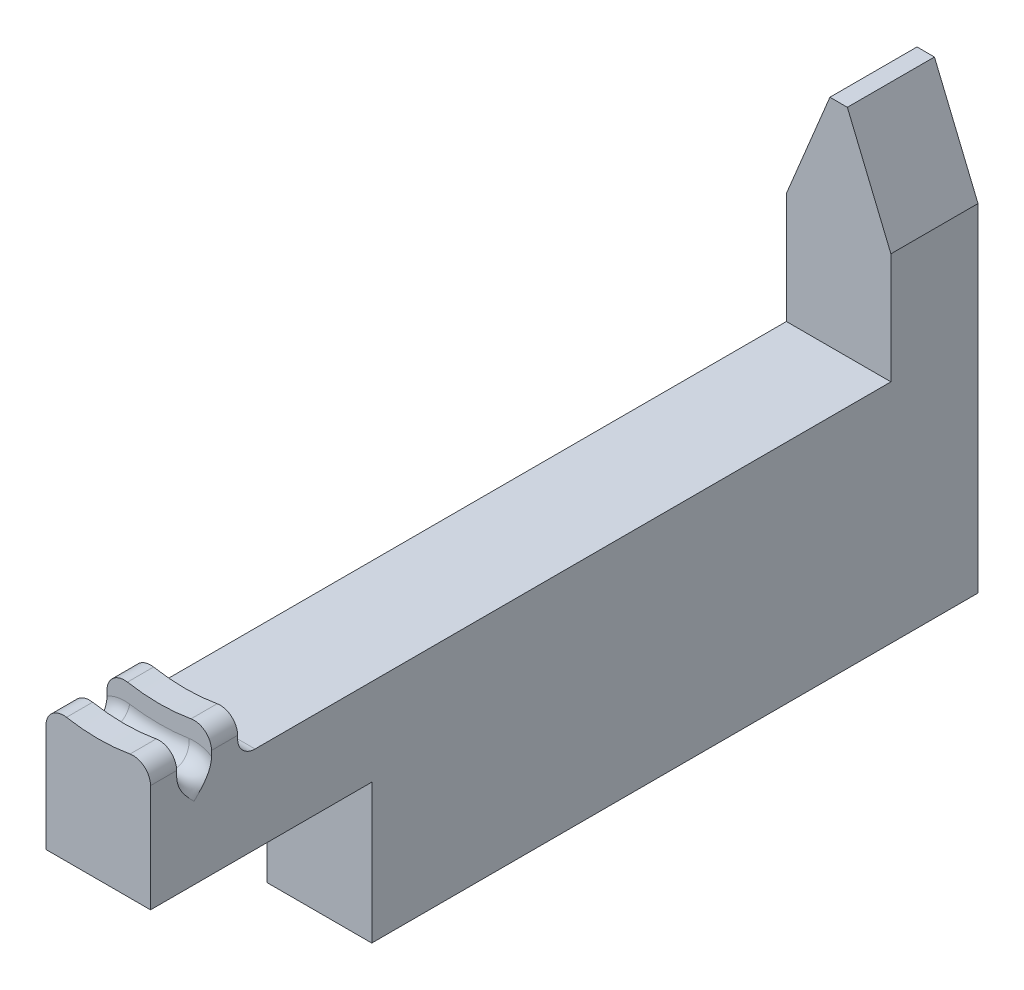
from build123d import *

# Parameters (mm, degrees)
BOSS_EXTRUDE1_DEPTH = 3
BOSS_EXTRUDE2_DEPTH = 2.5
SKETCH4_W           = 2
SKETCH4_H           = 2.442088572
FILLET1_R           = 1
FILLET2_R           = 1
CUT_EXTRUDE2_DEPTH  = 5
SKETCH6_W           = 34.8
SKETCH6_H           = 8
BOSS_EXTRUDE3_DEPTH = 3


with BuildPart() as part:
    # Sketch2 → Boss-Extrude1 (new, symmetric)
    with BuildSketch(Plane(origin=(0, 0, 0), x_dir=(0, 0, -1), z_dir=(1, 0, 0))):
        Polygon((0, 0), (40, 0), (40, 12.4), (45, 12.4), (45, -5), (0, -5), align=None)
    extrude(amount=BOSS_EXTRUDE1_DEPTH, both=True)

    # Sketch3 → Boss-Extrude2 (add, symmetric)
    with BuildSketch(Plane.XY):
        with BuildLine():
            Line((-3, 2.442088572), (-3, -5))
            Line((-3, -5), (3, -5))
            Line((3, -5), (3, 2.442088572))
            ThreePointArc((3, 2.442088572), (0, 2), (-3, 2.442088572))
        make_face()
    extrude(amount=BOSS_EXTRUDE2_DEPTH, both=True)

    # Sketch4 → Cut-Revolve1 (revolve, cut)
    with BuildSketch(Plane(origin=(0, 0, 0), x_dir=(0, 0, -1), z_dir=(1, 0, 0))):
        with Locations((0, 1.221044286)):
            Rectangle(SKETCH4_W, SKETCH4_H)
    revolve(axis=Axis((0, 12.4, 0), (0, 0, -1)), mode=Mode.SUBTRACT)

    # Fillet1
    fillet1_edges = [part.edges().sort_by_distance(p)[0] for p in [
        (-3, 2.442088572, 1.75),
        (0, 0, -2.5),
        (3, 2.442088572, 1.75),
        (-3, 2.442088572, -1.75),
        (3, 2.442088572, -1.75),
        (-3, 0.368375006, 0),
        (3, 0.368375006, 0),
    ]]
    fillet(fillet1_edges, radius=FILLET1_R)

    # Fillet2
    # the kernel refuses this fillet: 1 mm, written as the material it adds along each edge
    with BuildSketch(Plane(origin=(0, 12.4, -1), x_dir=(-0.14925373134328332, -0.9887989298538439, 0), z_dir=(-0.9887989298538439, 0.14925373134328332, 0))) as fillet2_piece_1:
        with BuildLine():
            CenterArc((12.4 - FILLET2_R, FILLET2_R), FILLET2_R, 270, 90)
            Line((12.4 - FILLET2_R, 0), (12.4, 0))
            Line((12.4, 0), (12.4, FILLET2_R))
        make_face()
    revolve(axis=Axis((0, 12.4, -1), (0, 0, 1)), revolution_arc=17.167363371)
    with BuildSketch(Plane(origin=(0, 12.4, 1), x_dir=(-0.14925373134328332, -0.9887989298538439, 0), z_dir=(-0.9887989298538439, 0.14925373134328332, 0))) as fillet2_piece_2:
        with BuildLine():
            CenterArc((12.4 - FILLET2_R, -FILLET2_R), FILLET2_R, 0, 90)
            Line((12.4 - FILLET2_R, 0), (12.4, 0))
            Line((12.4, 0), (12.4, -FILLET2_R))
        make_face()
    revolve(axis=Axis((0, 12.4, 1), (0, 0, 1)), revolution_arc=17.167363371)
    with BuildSketch(Plane(origin=(2, -0.84990566, -1), x_dir=(-0.8018642143213413, -0.5975063027205807, 0), z_dir=(-0.5975063027205807, 0.8018642143213413, 0))) as fillet2_piece_3_section:
        with BuildLine():
            CenterArc((1 + FILLET2_R, FILLET2_R), FILLET2_R, 180, 90)
            Line((1, FILLET2_R), (1, 0))
            Line((1, 0), (1 + FILLET2_R, 0))
        make_face()
    fillet2_piece_3 = revolve(axis=Axis((2, -0.84990566, -1), (0, 0, 1)), revolution_arc=241.892173959, mode=Mode.PRIVATE)
    fillet2_piece_3 = split(fillet2_piece_3, bisect_by=Plane(origin=(3, -0.02635607, -0.708719326), z_dir=(-1, 0, 0)), keep=Keep.TOP, mode=Mode.PRIVATE)
    add(fillet2_piece_3)
    with BuildSketch(Plane(origin=(2, -0.84990566, 1), x_dir=(-0.8018642143213406, -0.5975063027205816, 0), z_dir=(-0.5975063027205816, 0.8018642143213406, 0))) as fillet2_piece_4_section:
        with BuildLine():
            CenterArc((1 + FILLET2_R, -FILLET2_R), FILLET2_R, 90, 90)
            Line((1 + FILLET2_R, 0), (1, 0))
            Line((1, 0), (1, -FILLET2_R))
        make_face()
    fillet2_piece_4 = revolve(axis=Axis((2, -0.84990566, 1), (0, 0, 1)), revolution_arc=241.892173959, mode=Mode.PRIVATE)
    fillet2_piece_4 = split(fillet2_piece_4, bisect_by=Plane(origin=(3, -0.026356063, 0.70871933), z_dir=(-1, 0, 0)), keep=Keep.TOP, mode=Mode.PRIVATE)
    add(fillet2_piece_4)
    with BuildSketch(Plane(origin=(-2, -0.84990566, -1), x_dir=(0.8018642143213416, -0.5975063027205804, 0), z_dir=(0.5975063027205804, 0.8018642143213416, 0))) as fillet2_piece_5_section:
        with BuildLine():
            CenterArc((1 + FILLET2_R, -FILLET2_R), FILLET2_R, 90, 90)
            Line((1 + FILLET2_R, 0), (1, 0))
            Line((1, 0), (1, -FILLET2_R))
        make_face()
    fillet2_piece_5 = revolve(axis=Axis((-2, -0.84990566, -1), (0, 0, -1)), revolution_arc=241.892173959, mode=Mode.PRIVATE)
    fillet2_piece_5 = split(fillet2_piece_5, bisect_by=Plane(origin=(-3, -0.026356035, -0.70871925), z_dir=(1, 0, 0)), keep=Keep.TOP, mode=Mode.PRIVATE)
    add(fillet2_piece_5)
    with BuildSketch(Plane(origin=(-2, -0.84990566, 1), x_dir=(0.8018642143213416, -0.5975063027205804, 0), z_dir=(0.5975063027205804, 0.8018642143213416, 0))) as fillet2_piece_6_section:
        with BuildLine():
            CenterArc((1 + FILLET2_R, FILLET2_R), FILLET2_R, 180, 90)
            Line((1 + FILLET2_R, 0), (1, 0))
            Line((1, 0), (1, FILLET2_R))
        make_face()
    fillet2_piece_6 = revolve(axis=Axis((-2, -0.84990566, 1), (0, 0, -1)), revolution_arc=241.892173959, mode=Mode.PRIVATE)
    fillet2_piece_6 = split(fillet2_piece_6, bisect_by=Plane(origin=(-3, -0.026356028, 0.708719255), z_dir=(1, 0, 0)), keep=Keep.TOP, mode=Mode.PRIVATE)
    add(fillet2_piece_6)

    # Sketch5 → Cut-Extrude2 (cut)
    with BuildSketch(Plane.XY.offset(-40)):
        Polygon((3, 6.364466094), (0.5, 12.4), (3, 12.4), align=None)
        Polygon((-0.5, 12.4), (-3, 6.364466094), (-3, 12.4), align=None)
    extrude(amount=-CUT_EXTRUDE2_DEPTH, mode=Mode.SUBTRACT)

    # Sketch6 → Boss-Extrude3 (add, symmetric)
    with BuildSketch(Plane(origin=(0, 0, 0), x_dir=(0, 0, -1), z_dir=(1, 0, 0))):
        with Locations((27.6, -9)):
            Rectangle(SKETCH6_W, SKETCH6_H)
    extrude(amount=BOSS_EXTRUDE3_DEPTH, both=True)


solid = part.part
